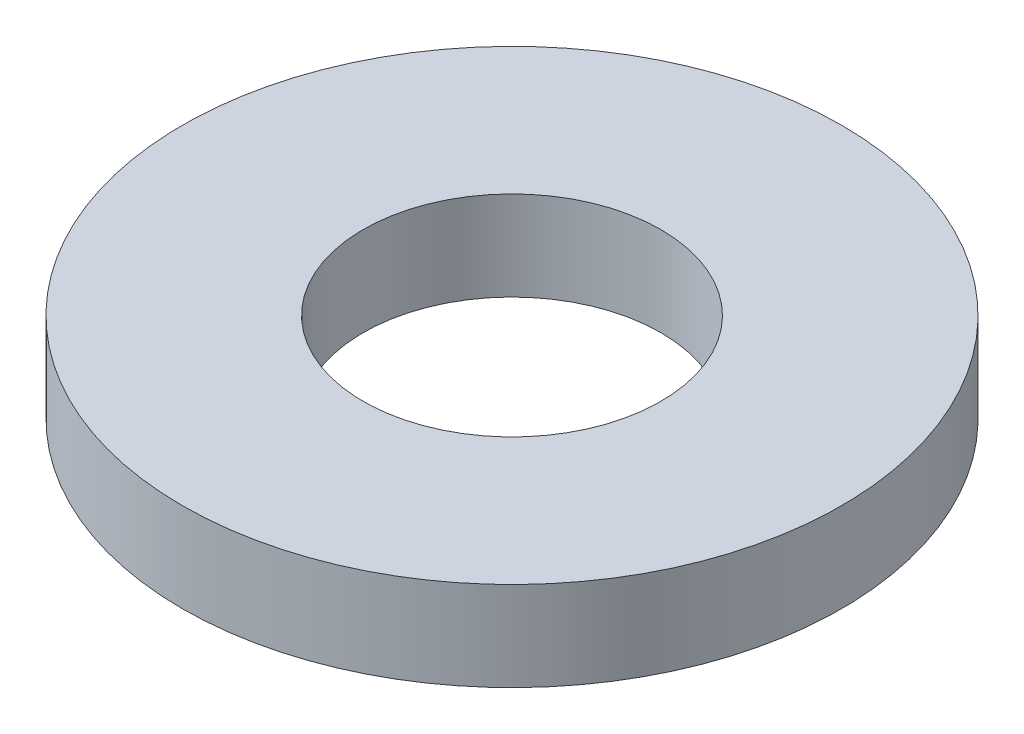
from build123d import *

# Parameters (mm, degrees)
SKETCH1_R           = 77.5
BOSS_EXTRUDE1_DEPTH = 21
SKETCH2_R           = 35
CUT_EXTRUDE1_DEPTH  = 112.595250795


with BuildPart() as part:
    # Sketch1 → Boss-Extrude1 (new body)
    with BuildSketch(Plane(origin=(0, 0, 0), x_dir=(1, 0, 0), z_dir=(0, 1, 0))):
        Circle(SKETCH1_R)
    extrude(amount=BOSS_EXTRUDE1_DEPTH)

    # Sketch2 → Cut-Extrude1 (cut, through all)
    with BuildSketch(Plane(origin=(0, 0, 0), x_dir=(1, 0, 0), z_dir=(0, 1, 0))):
        Circle(SKETCH2_R)
    extrude(amount=CUT_EXTRUDE1_DEPTH, mode=Mode.SUBTRACT)


solid = part.part
